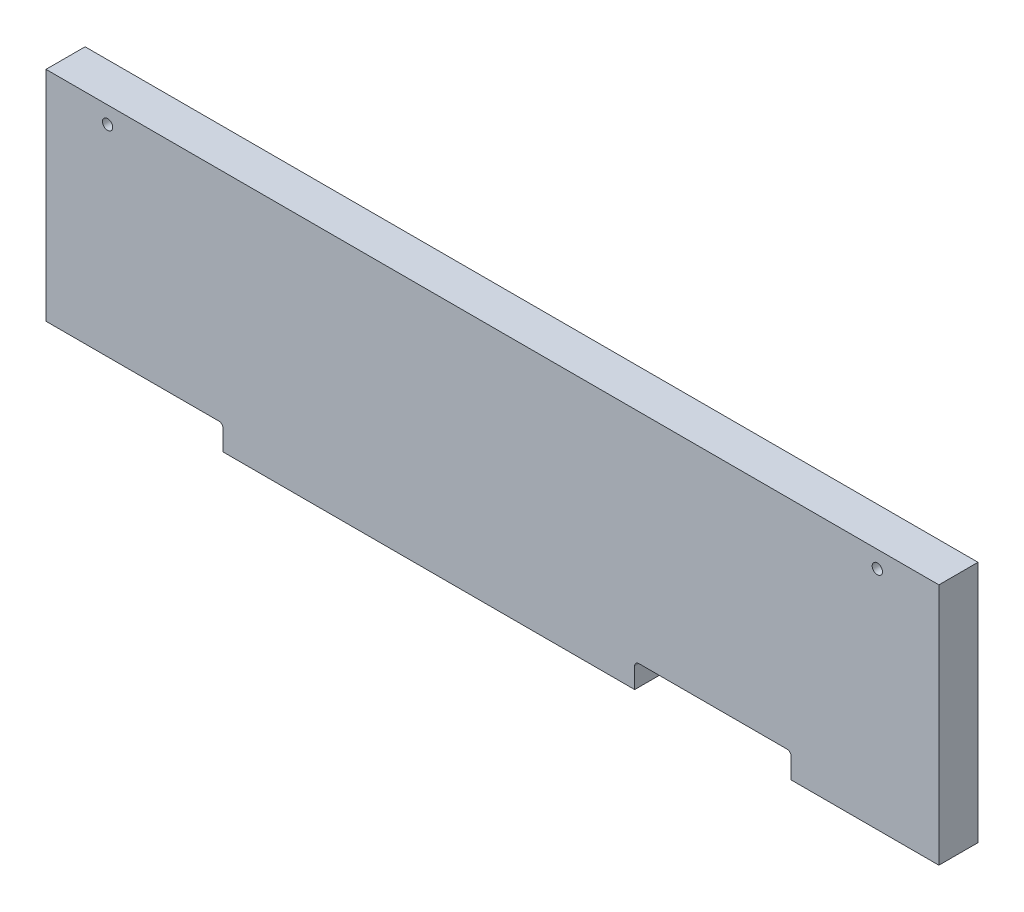
from build123d import *

# Parameters (mm, degrees)
SKETCH1_W           = 435
SKETCH1_H           = 118.3
BOSS_EXTRUDE1_DEPTH = 19.05
SKETCH2_W           = 76.2
SKETCH2_H           = 12
CUT_EXTRUDE1_DEPTH  = 324.044567359
FILLET1_R           = 2
SKETCH3_R           = 2.5
CUT_EXTRUDE2_DEPTH  = 324.044567359


with BuildPart() as part:
    # Sketch1 → Boss-Extrude1 (new body)
    with BuildSketch(Plane.XY):
        with Locations((82.5, 59.15)):
            Rectangle(SKETCH1_W, SKETCH1_H)
    extrude(amount=BOSS_EXTRUDE1_DEPTH)

    # Sketch2 → Cut-Extrude1 (cut, through all)
    with BuildSketch(Plane.XY.offset(19.05)):
        Polygon((-48.8, 12), (-125, 12), (-135, 12), (-135, 0), (-125, 0), (-48.8, 0), align=None)
        with Locations((189.9, 6)):
            Rectangle(SKETCH2_W, SKETCH2_H)
    extrude(amount=-CUT_EXTRUDE1_DEPTH, mode=Mode.SUBTRACT)

    # Fillet1
    fillet1_edges = [part.edges().sort_by_distance(p)[0] for p in [
        (151.8, 12, 9.525),
        (228, 12, 9.525),
        (-48.8, 12, 9.525),
    ]]
    fillet(fillet1_edges, radius=FILLET1_R)

    # Sketch3 → Cut-Extrude2 (cut, through all)
    with BuildSketch(Plane(origin=(0, 0, 0), x_dir=(-1, 0, 0), z_dir=(0, 0, -1))):
        with Locations((105, 110.05)):
            Circle(SKETCH3_R)
        with Locations((-270, 110.05)):
            Circle(SKETCH3_R)
    extrude(amount=-CUT_EXTRUDE2_DEPTH, mode=Mode.SUBTRACT)


solid = part.part
